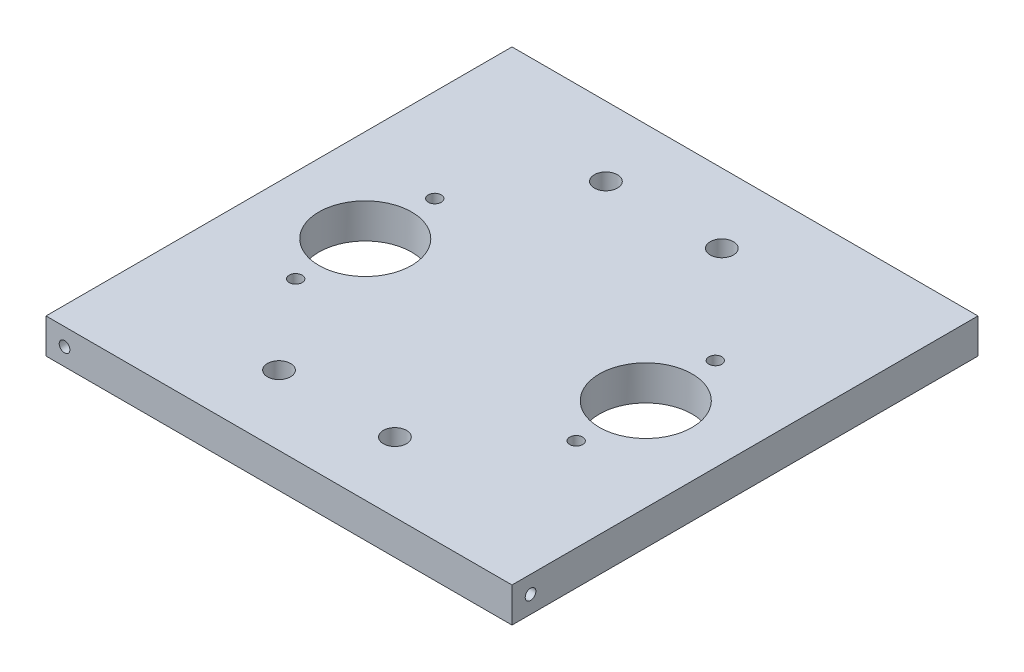
from build123d import *

# Parameters (mm, degrees)
SKETCH1_W                      = 127.635
SKETCH1_H                      = 127.635
MAIN_PLATE_DEPTH               = 9.525
SKETCH2_R                      = 3.175
U_BOLT_HOLE_DEPTH              = 12.7
U_BOLT_PATTERN_COUNT           = 2
U_BOLT_PATTERN_PITCH           = 31.75
U_BOLT_PATTERN_COUNT_DIR2      = 2
U_BOLT_PATTERN_PITCH_DIR2      = 89.535
SKETCH3_R                      = 1.778
RAPTOR_BOLT_HOLE_DEPTH         = 12.7
RAPTOR_BOLT_PATTERN_COUNT      = 2
RAPTOR_BOLT_PATTERN_PITCH      = 38.1
RAPTOR_BOLT_PATTERN_COUNT_DIR2 = 2
RAPTOR_BOLT_PATTERN_PITCH_DIR2 = 76.835
SKETCH4_R                      = 12.7
CO2_CYLINDER_HOLE_DEPTH        = 12.7
CO2_PATTERN_COUNT              = 2
CO2_PATTERN_PITCH              = 76.835
SKETCH5_R                      = 1.4605
FRAME_ATTACHMENT_HOLE_1_DEPTH  = 12.7
SKETCH6_R                      = 1.4605
FRAME_ATTACHMENT_HOLE_2_DEPTH  = 12.7
SKETCH7_R                      = 1.4605
FRAME_ATTACHMENT_HOLE_3_DEPTH  = 12.7
SKETCH8_R                      = 1.4605
FRAME_ATTACHMENT_HOLE_4_DEPTH  = 12.7


with BuildPart() as part:
    # Sketch1 → Main Plate (new body)
    with BuildSketch(Plane(origin=(0, 0, 0), x_dir=(1, 0, 0), z_dir=(0, 1, 0))):
        with Locations((63.8175, 63.8175)):
            Rectangle(SKETCH1_W, SKETCH1_H)
    extrude(amount=MAIN_PLATE_DEPTH)

    # Sketch2 → U-Bolt Hole (cut)
    with BuildSketch(Plane(origin=(0, 9.525, 0), x_dir=(1, 0, 0), z_dir=(0, 1, 0))):
        with Locations((44.7675, 108.585)):
            Circle(SKETCH2_R)
    u_bolt_hole = extrude(amount=-U_BOLT_HOLE_DEPTH, mode=Mode.SUBTRACT)

    # U-Bolt Pattern: U-Bolt Hole 2 × 2
    with Locations(*[(i * U_BOLT_PATTERN_PITCH, 0, j * U_BOLT_PATTERN_PITCH_DIR2) for i in range(U_BOLT_PATTERN_COUNT) for j in range(U_BOLT_PATTERN_COUNT_DIR2) if (i, j) != (0, 0)]):
        add(u_bolt_hole, mode=Mode.SUBTRACT)

    # Sketch3 → Raptor Bolt Hole (cut)
    with BuildSketch(Plane(origin=(0, 9.525, 0), x_dir=(1, 0, 0), z_dir=(0, 1, 0))):
        with Locations((25.4, 42.9895)):
            Circle(SKETCH3_R)
    raptor_bolt_hole = extrude(amount=-RAPTOR_BOLT_HOLE_DEPTH, mode=Mode.SUBTRACT)

    # Raptor Bolt Pattern: Raptor Bolt Hole 2 × 2
    with Locations(*[(j * RAPTOR_BOLT_PATTERN_PITCH_DIR2, 0, -i * RAPTOR_BOLT_PATTERN_PITCH) for i in range(RAPTOR_BOLT_PATTERN_COUNT) for j in range(RAPTOR_BOLT_PATTERN_COUNT_DIR2) if (i, j) != (0, 0)]):
        add(raptor_bolt_hole, mode=Mode.SUBTRACT)

    # Sketch4 → Co2 Cylinder Hole (cut)
    with BuildSketch(Plane(origin=(0, 9.525, 0), x_dir=(1, 0, 0), z_dir=(0, 1, 0))):
        with Locations((25.4, 62.0395)):
            Circle(SKETCH4_R)
    co2_cylinder_hole = extrude(amount=-CO2_CYLINDER_HOLE_DEPTH, mode=Mode.SUBTRACT)

    # Co2 Pattern: Co2 Cylinder Hole ×2
    with Locations(*[(i * CO2_PATTERN_PITCH, 0, 0) for i in range(1, CO2_PATTERN_COUNT)]):
        add(co2_cylinder_hole, mode=Mode.SUBTRACT)

    # Sketch5 → Frame attachment hole 1 (cut)
    with BuildSketch(Plane.XY):
        with Locations((5.08, 4.7625)):
            Circle(SKETCH5_R)
    extrude(amount=-FRAME_ATTACHMENT_HOLE_1_DEPTH, mode=Mode.SUBTRACT)

    # Sketch6 → Frame attachment hole 2 (cut)
    with BuildSketch(Plane.ZY):
        with Locations((-122.555, 4.7625)):
            Circle(SKETCH6_R)
    extrude(amount=-FRAME_ATTACHMENT_HOLE_2_DEPTH, mode=Mode.SUBTRACT)

    # Sketch7 → Frame attachment hole 3 (cut)
    with BuildSketch(Plane(origin=(0, 0, -127.635), x_dir=(-1, 0, 0), z_dir=(0, 0, -1))):
        with Locations((-122.555, 4.7625)):
            Circle(SKETCH7_R)
    extrude(amount=-FRAME_ATTACHMENT_HOLE_3_DEPTH, mode=Mode.SUBTRACT)

    # Sketch8 → Frame attachment hole 4 (cut)
    with BuildSketch(Plane(origin=(127.635, 0, 0), x_dir=(0, 0, -1), z_dir=(1, 0, 0))):
        with Locations((5.08, 4.7625)):
            Circle(SKETCH8_R)
    extrude(amount=-FRAME_ATTACHMENT_HOLE_4_DEPTH, mode=Mode.SUBTRACT)


solid = part.part
